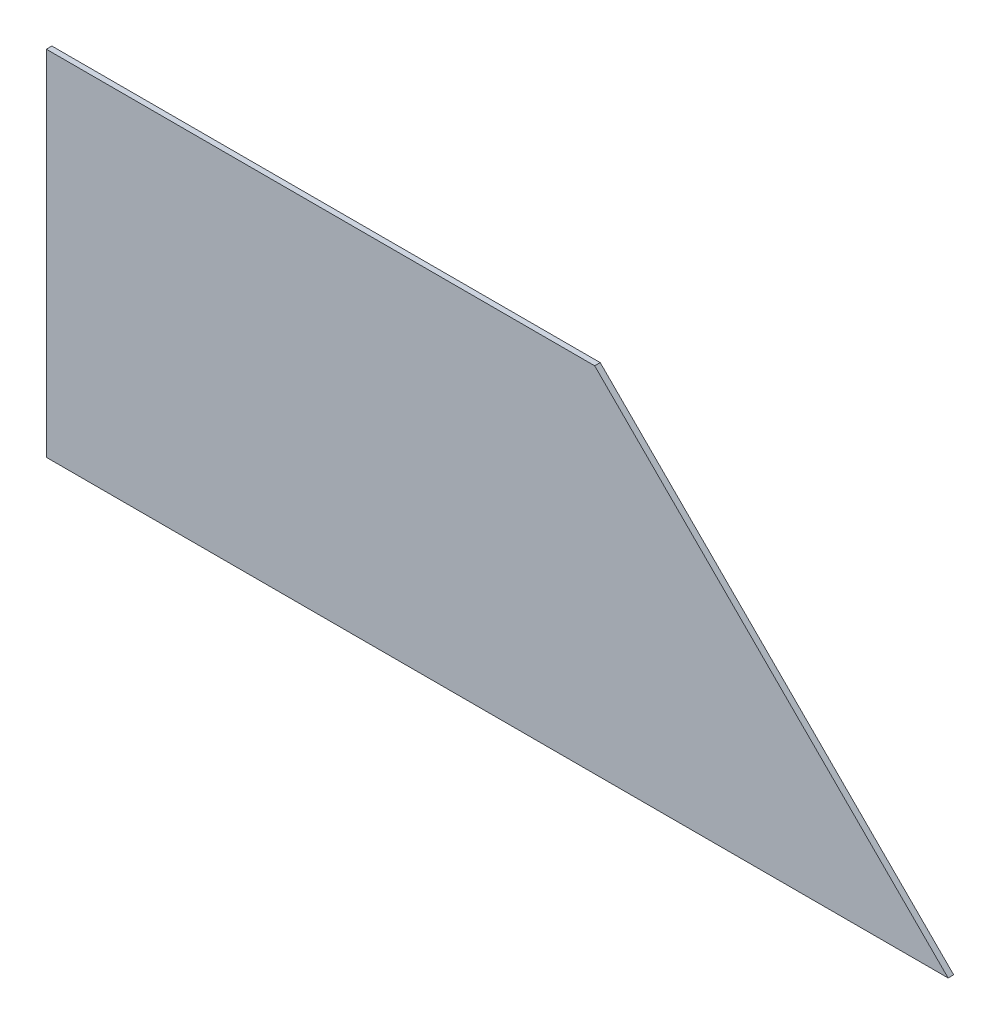
from build123d import *

# Parameters (mm, degrees)
BOSS_EXTRUDE1_DEPTH = 3.175


with BuildPart() as part:
    # Sketch1 → Boss-Extrude1 (new body)
    with BuildSketch(Plane.XY):
        Polygon((315.214, 203.2), (518.414, 0), (127, 0), (0, 0), (0, 203.2), align=None)
    extrude(amount=BOSS_EXTRUDE1_DEPTH)


solid = part.part
